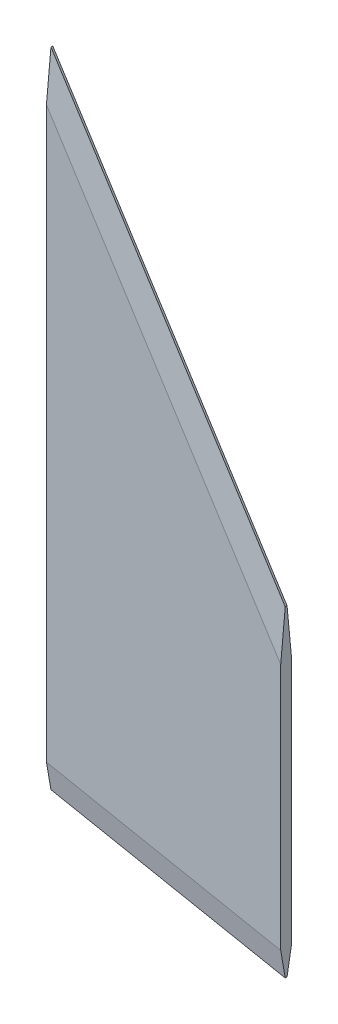
from build123d import *
from OCP.BRepFilletAPI import BRepFilletAPI_MakeChamfer

# Parameters (mm, degrees)
BOSS_EXTRUDE1_DEPTH = 1.5
CHAMFER1_SIZE       = 1.25
CHAMFER1_SIZE2      = 7.089102275


with BuildPart() as part:
    # Sketch1 → Boss-Extrude1 (new, symmetric)
    with BuildSketch(Plane.XY):
        Polygon((-60.98159975, 89.806512683), (-60.98159975, -87.993487317), (3.78840025, -100.693487317), (3.78840025, -11.793487317), align=None)
    extrude(amount=BOSS_EXTRUDE1_DEPTH, both=True)

    # Chamfer1: one chamfer whose edges measure the first distance from different faces: ONE call of the kernel's chamfer builder (chamfer() names one face for all edges)
    chamfer1_edges_1 = [part.edges().sort_by_distance(p)[0] for p in [
        (-28.59659975, -94.343487317, -1.5),
        (-28.59659975, -94.343487317, 1.5),
    ]]
    chamfer1_side_1 = [part.faces().sort_by_distance(p)[0] for p in [
        (-28.59659975, -94.343487317, 0),
    ]]
    chamfer1_edges_2 = [part.edges().sort_by_distance(p)[0] for p in [
        (-28.59659975, 39.006512683, -1.5),
        (-28.59659975, 39.006512683, 1.5),
    ]]
    chamfer1_side_2 = [part.faces().sort_by_distance(p)[0] for p in [
        (-28.59659975, 39.006512683, 0),
    ]]
    chamfer1 = BRepFilletAPI_MakeChamfer(part.part.solid().wrapped)
    for e in chamfer1_edges_1:
        chamfer1.Add(CHAMFER1_SIZE, CHAMFER1_SIZE2, e.wrapped, chamfer1_side_1[0].wrapped)  # the first distance lies on this face
    for e in chamfer1_edges_2:
        chamfer1.Add(CHAMFER1_SIZE, CHAMFER1_SIZE2, e.wrapped, chamfer1_side_2[0].wrapped)  # the first distance lies on this face
    add(Compound.cast(chamfer1.Shape()), mode=Mode.REPLACE)


solid = part.part
